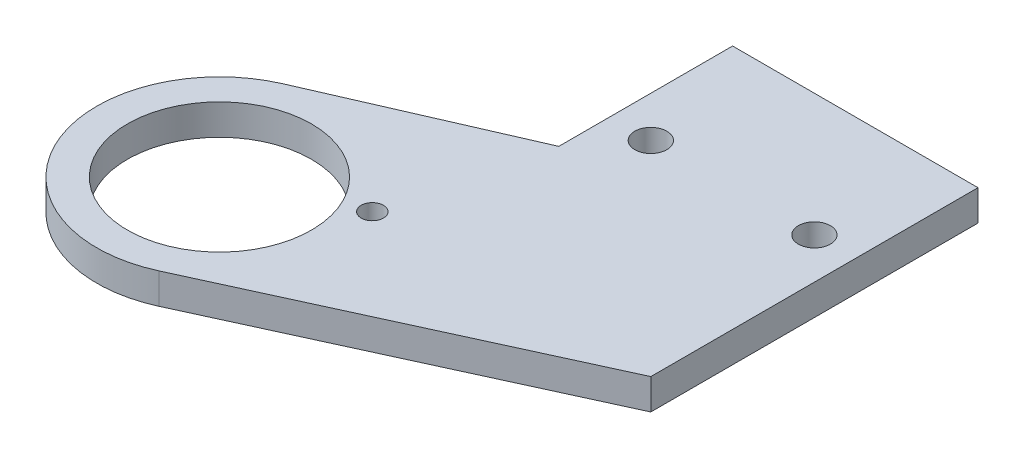
from build123d import *

# Parameters (mm, degrees)
SKETCH2_R                 = 14.2875
BOSS_EXTRUDE1_DEPTH       = 4.7625
TAP_DRILL_FOR_8_32_TAP1_D = 3.4544
F_10_CLEARANCE_HOLE1_D    = 4.9784


with BuildPart() as part:
    # Sketch2 → Boss-Extrude1 (new body)
    with BuildSketch(Plane(origin=(0, 0, 0), x_dir=(1, 0, 0), z_dir=(0, 1, 0))):
        with BuildLine():
            Line((19.05, 0), (-19.05, 0))
            Line((-19.05, 0), (-19.05, -26.9875))
            Line((-19.05, -26.9875), (-48.883968147, -39.985679272))
            ThreePointArc((-48.883968147, -39.985679272), (-58.667673568, -65.221680031), (-33.341491014, -74.769512421))
            Line((-33.341491014, -74.769512421), (19.05, -50.8))
            Line((19.05, -50.8), (19.05, 0))
        make_face()
        with Locations((-41.275, -57.450103217)):
            Circle(SKETCH2_R, mode=Mode.SUBTRACT)
    extrude(amount=BOSS_EXTRUDE1_DEPTH)

    # Tap Drill for #8-32 Tap1 (through all)
    with Locations(Plane(origin=(0, 4.7625, 0), x_dir=(1, 0, 0), z_dir=(0, 1, 0))):
        with Locations((-24.742011998, -50.246946705)):
            Hole(TAP_DRILL_FOR_8_32_TAP1_D / 2)

    # #10 Clearance Hole1 (through all)
    with Locations(Plane(origin=(0, 4.7625, 0), x_dir=(1, 0, 0), z_dir=(0, 1, 0))):
        with Locations((-12.7, -19.05), (12.7, -19.05)):
            Hole(F_10_CLEARANCE_HOLE1_D / 2)


solid = part.part
